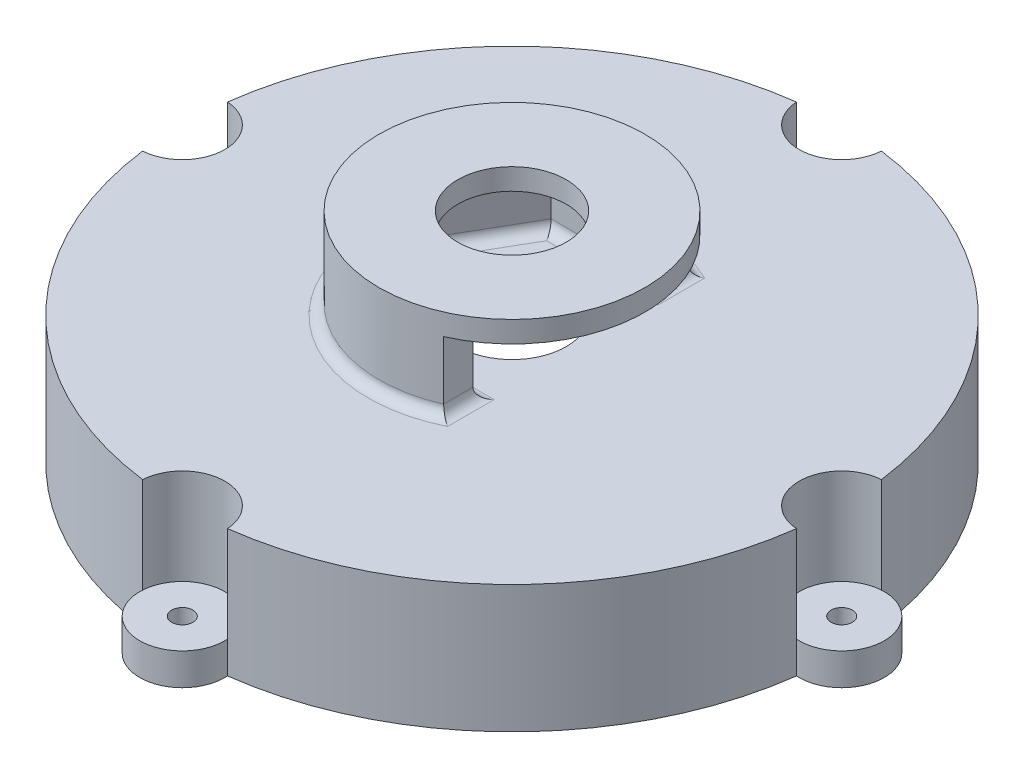
from build123d import *
from build123d.topology import SkipClean

# Parameters (mm, degrees)
SKETCH2_R           = 1
SKETCH2_R_2         = 26
BOSS_EXTRUDE1_DEPTH = 10
SKETCH3_R           = 31
SKETCH3_R_2         = 5.1
BOSS_EXTRUDE2_DEPTH = 2
BOSS_EXTRUDE3_DEPTH = 6.5
SKETCH5_R           = 12.5
SKETCH5_R_2         = 5.1
BOSS_EXTRUDE4_DEPTH = 2
FILLET1_R           = 1
BOSS_EXTRUDE5_START = 6.5
BOSS_EXTRUDE5_DEPTH = 6.5
FILLET2_R           = 1
CUT_EXTRUDE1_START  = -9
SKETCH7_R           = 4
CUT_EXTRUDE1_DEPTH  = 9
BOSS_EXTRUDE6_START = 10
BOSS_EXTRUDE6_DEPTH = 10
CIRPATTERN1_COUNT   = 4
SKETCH12_R          = 26
CUT_EXTRUDE2_DEPTH  = 3


with BuildPart() as part:
    # Sketch2 → Boss-Extrude1 (new body)
    with BuildSketch(Plane(origin=(0, 0, 0), x_dir=(1, 0, 0), z_dir=(0, 1, 0))):
        with BuildLine():
            ThreePointArc((3.991666658, 30.741935484), (0, 35), (-3.991666658, 30.741935484))
            ThreePointArc((-3.991666658, 30.741935484), (-21.920310217, 21.920310217), (-30.741935484, 3.991666658))
            ThreePointArc((-30.741935484, 3.991666658), (-35, 0), (-30.741935484, -3.991666658))
            ThreePointArc((-30.741935484, -3.991666658), (-21.920310217, -21.920310217), (-3.991666658, -30.741935484))
            ThreePointArc((-3.991666658, -30.741935484), (0, -35), (3.991666658, -30.741935484))
            ThreePointArc((3.991666658, -30.741935484), (21.920310217, -21.920310217), (30.741935484, -3.991666658))
            ThreePointArc((30.741935484, -3.991666658), (35, 0), (30.741935484, 3.991666658))
            ThreePointArc((30.741935484, 3.991666658), (21.920310217, 21.920310217), (3.991666658, 30.741935484))
        make_face()
        with Locations(Location((0, 31, 0), (0, 0, 270))):
            Circle(SKETCH2_R, mode=Mode.SUBTRACT)
        with Locations(Location((31, 0, 0), (0, 0, 270))):
            Circle(SKETCH2_R, mode=Mode.SUBTRACT)
        with Locations(Location((0, -31, 0), (0, 0, 270))):
            Circle(SKETCH2_R, mode=Mode.SUBTRACT)
        with Locations(Location((-31, 0, 0), (0, 0, 270))):
            Circle(SKETCH2_R, mode=Mode.SUBTRACT)
        with Locations(Location((0, 0, 0), (0, 0, 270))):
            Circle(SKETCH2_R_2, mode=Mode.SUBTRACT)
    extrude(amount=BOSS_EXTRUDE1_DEPTH)

    # Sketch3 → Boss-Extrude2 (add)
    with BuildSketch(Plane(origin=(0, 10, 0), x_dir=(1, 0, 0), z_dir=(0, 1, 0))):
        with Locations(Location((0, 0, 0), (0, 0, 88.151668903))):
            Circle(SKETCH3_R)
        with Locations(Location((0, 0, 0), (0, 0, 270))):
            Circle(SKETCH3_R_2, mode=Mode.SUBTRACT)
    extrude(amount=BOSS_EXTRUDE2_DEPTH)

    # Sketch4 → Boss-Extrude3 (add)
    with BuildSketch(Plane(origin=(0, 12, 0), x_dir=(1, 0, 0), z_dir=(0, 1, 0))):
        Polygon((-5.022947342, 8.7), (-10.045894684, 0), (-5.022947342, -8.7), (5.022947342, -8.7), (5.022947342, -10.7), (-6.17764788, -10.7), (-12.355295761, 0), (-6.17764788, 10.7), (5.022947342, 10.7), (5.022947342, 8.7), align=None)
    extrude(amount=BOSS_EXTRUDE3_DEPTH)

    # Sketch5 → Boss-Extrude4 (add)
    with BuildSketch(Plane(origin=(0, 18.5, 0), x_dir=(1, 0, 0), z_dir=(0, 1, 0))):
        with Locations(Location((0, 0, 0), (0, 0, 270))):
            Circle(SKETCH5_R)
        with Locations(Location((0, 0, 0), (0, 0, 270))):
            Circle(SKETCH5_R_2, mode=Mode.SUBTRACT)
    extrude(amount=BOSS_EXTRUDE4_DEPTH)

    # Fillet1
    fillet1_edges = [part.edges().sort_by_distance(p)[0] for p in [
        (0, 12, -8.7),
        (0, 12, 8.7),
        (-7.534421013, 12, 4.35),
        (-7.534421013, 12, -4.35),
        (-10.045894684, 15.25, 0),
        (0, 18.5, -8.7),
        (0, 18.5, 8.7),
        (-7.534421013, 18.5, 4.35),
        (-7.534421013, 18.5, -4.35),
    ]]
    fillet(fillet1_edges, radius=FILLET1_R)

    # Sketch6 → Boss-Extrude5 (add)
    with SkipClean():  # the faces are left unmerged after this step: merging them gives an invalid solid
        with BuildSketch(Plane.XZ.offset(-18.5).offset(BOSS_EXTRUDE5_START)):
            with BuildLine():
                Line((-6.17764788, -10.7), (-12.355295761, 0))
                Line((-12.355295761, 0), (-6.17764788, 10.7))
                Line((-6.17764788, 10.7), (5.022947342, 10.7))
                Line((5.022947342, 10.7), (5.022947342, 11.446396813))
                ThreePointArc((5.022947342, 11.446396813), (-12.5, 0), (5.022947342, -11.446396813))
                Line((5.022947342, -11.446396813), (5.022947342, -10.7))
                Line((5.022947342, -10.7), (-6.17764788, -10.7))
            make_face()
        extrude(amount=-BOSS_EXTRUDE5_DEPTH)

    # Fillet2
    fillet2_edges = [part.edges().sort_by_distance(p)[0] for p in [
        (-12.5, 12, 0),
        (5.022947342, 12, -9.2),
        (5.022947342, 12, 9.2),
    ]]
    fillet(fillet2_edges, radius=FILLET2_R)

    # Sketch7 → Cut-Extrude1 (cut)
    with BuildSketch(Plane(origin=(0, 12, 0), x_dir=(1, 0, 0), z_dir=(0, 1, 0)).offset(CUT_EXTRUDE1_START)):
        with Locations((0, -31)):
            Circle(SKETCH7_R)
        with Locations((31, 0)):
            Circle(SKETCH7_R)
        with Locations((0, 31)):
            Circle(SKETCH7_R)
        with Locations((-31, 0)):
            Circle(SKETCH7_R)
    extrude(amount=CUT_EXTRUDE1_DEPTH, mode=Mode.SUBTRACT)

    # Sketch10 → Boss-Extrude6 (add)
    with BuildSketch(Plane.XZ.offset(-10).offset(BOSS_EXTRUDE6_START)):
        with BuildLine():
            Line((-4, 25.690465157), (-4, 15))
            Line((-4, 15), (4, 15))
            Line((4, 15), (4, 25.690465157))
            ThreePointArc((4, 25.690465157), (0, 26), (-4, 25.690465157))
        make_face()
    boss_extrude6 = extrude(amount=-BOSS_EXTRUDE6_DEPTH)

    # CirPattern1: Boss-Extrude6 ×4 about axis
    cirpattern1_axis = Axis((0, 0, 0), (0, 1, 0))
    for i in range(1, CIRPATTERN1_COUNT):
        add(boss_extrude6.rotate(cirpattern1_axis, i * 360 / CIRPATTERN1_COUNT))

    # Sketch12 → Cut-Extrude2 (cut)
    with SkipClean():  # the faces are left unmerged after this step: merging them gives an invalid solid
        with BuildSketch(Plane.XZ):
            with Locations(Location((0, 0, 0), (0, 0, 261.150116902))):
                Circle(SKETCH12_R)
        extrude(amount=-CUT_EXTRUDE2_DEPTH, mode=Mode.SUBTRACT)
    add(part.part.scale(1), mode=Mode.REPLACE)  # the faces are merged on a copy


solid = part.part
